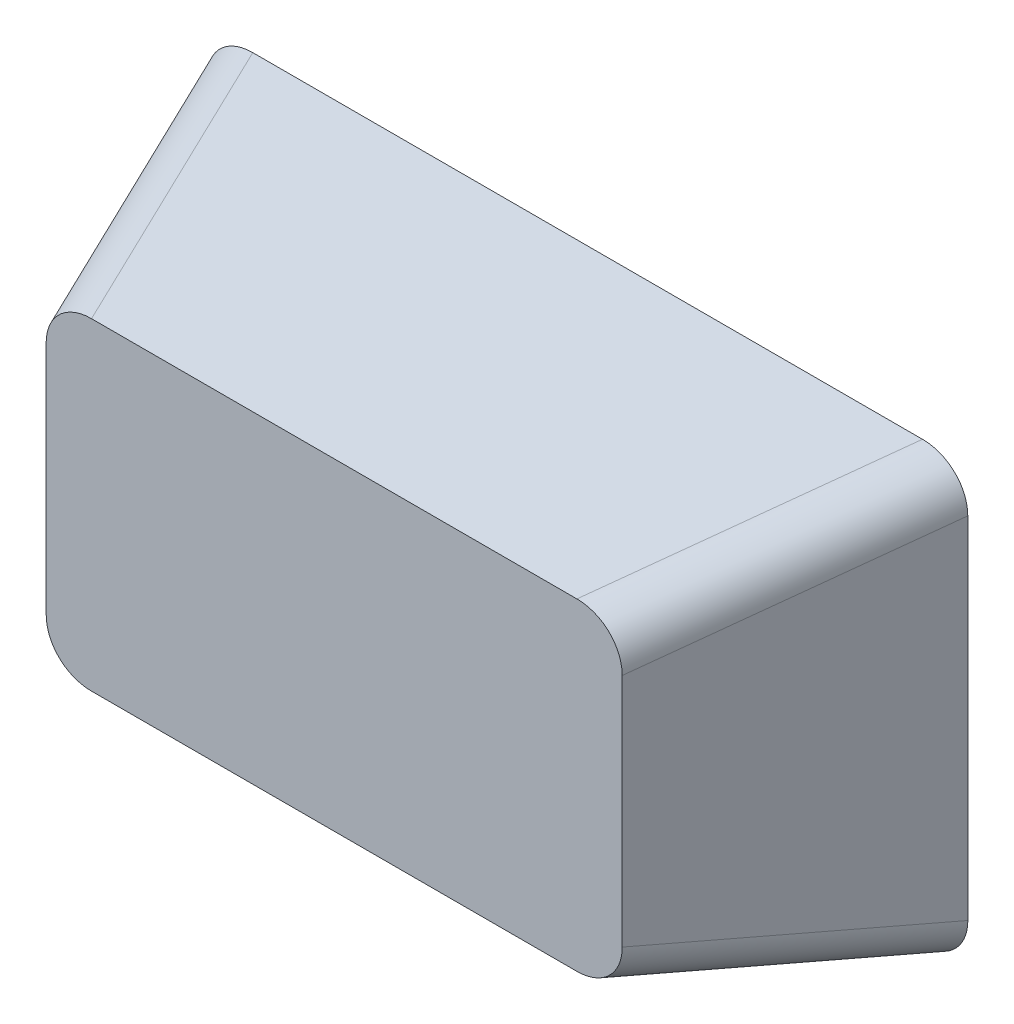
from build123d import *

# Parameters (mm, degrees)
FILLET1_R = 10


with BuildPart() as part:
    # Sketch3 → Loft1 section 0
    with BuildSketch(Plane.XY):
        with BuildLine():
            Line((62.5, -35), (-62.5, -35))
            Line((-62.5, -35), (-62.5, 35))
            Line((-62.5, 35), (62.5, 35))
            Line((62.5, 35), (62.5, -35))
        make_face()
    # Sketch4 → Loft1 section 1
    with BuildSketch(Plane.XY.offset(-55)):
        with BuildLine():
            Line((82.5, -47.5), (-82.5, -47.5))
            Line((-82.5, -47.5), (-82.5, 47.5))
            Line((-82.5, 47.5), (82.5, 47.5))
            Line((82.5, 47.5), (82.5, -47.5))
        make_face()
    loft()

    # Sketch7 → Cut-Loft2 section 0
    with BuildSketch(Plane.XY.offset(-55)):
        with BuildLine():
            Line((77.5, -42.5), (-77.5, -42.5))
            Line((-77.5, -42.5), (-77.5, 42.5))
            Line((-77.5, 42.5), (77.5, 42.5))
            Line((77.5, 42.5), (77.5, -42.5))
        make_face()
    # Sketch5 → Cut-Loft2 section 1
    with BuildSketch(Plane.XY.offset(-27.5)):
        with BuildLine():
            Line((22.5, -12.5), (-22.5, -12.5))
            Line((-22.5, -12.5), (-22.5, 12.5))
            Line((-22.5, 12.5), (22.5, 12.5))
            Line((22.5, 12.5), (22.5, -12.5))
        make_face()
    loft(mode=Mode.SUBTRACT)

    # Fillet1
    fillet1_edges = [part.edges().sort_by_distance(p)[0] for p in [
        (-72.5, -41.25, -27.5),
        (-72.5, 41.25, -27.5),
        (72.5, -41.25, -27.5),
        (72.5, 41.25, -27.5),
    ]]
    fillet(fillet1_edges, radius=FILLET1_R)


solid = part.part
